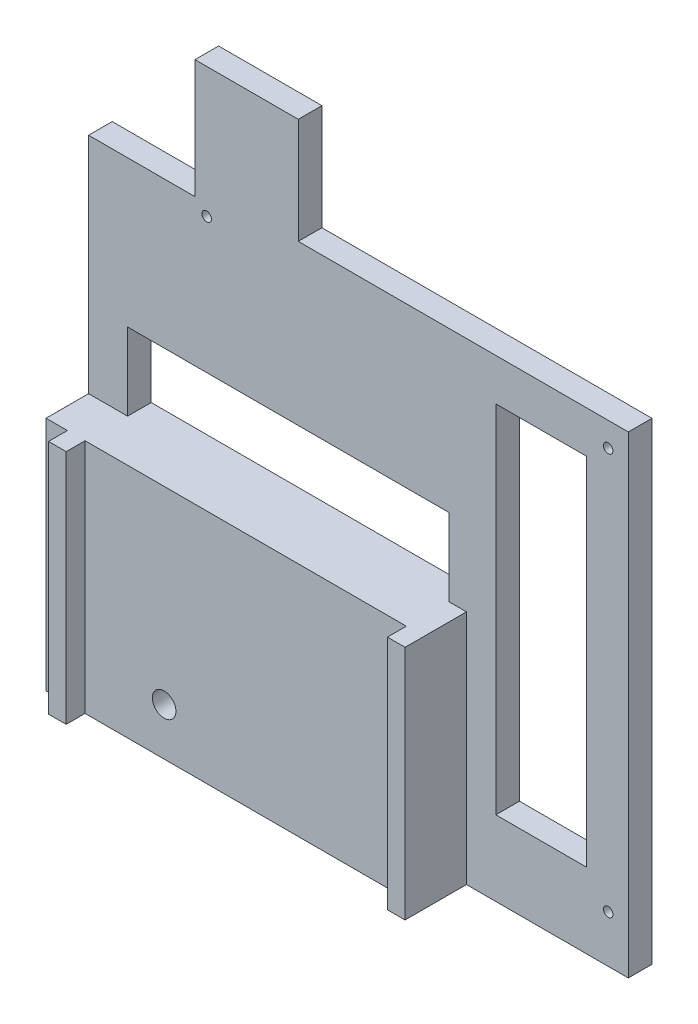
from build123d import *

# Parameters (mm, degrees)
SKETCH1_W           = 250
SKETCH1_H           = 245
BOSS_EXTRUDE1_DEPTH = 10
SKETCH6_W           = 160
SKETCH6_H           = 100
BOSS_EXTRUDE3_DEPTH = 18
SKETCH7_W           = 7.48
SKETCH7_H           = 100
BOSS_EXTRUDE4_DEPTH = 8
SKETCH8_W           = 152.52
SKETCH8_H           = 92.52
CUT_EXTRUDE2_DEPTH  = 20
SKETCH9_W           = 22
SKETCH9_H           = 22
BOSS_EXTRUDE5_DEPTH = 20
SKETCH11_W          = 18
SKETCH11_H          = 10
CUT_EXTRUDE4_DEPTH  = 22
SKETCH12_W          = 45.049420001
SKETCH12_H          = 50.23697577
SKETCH12_W_2        = 38.335801694
SKETCH12_H_2        = 150.676093074
SKETCH12_W_3        = 136
SKETCH12_H_3        = 32.712997572
CUT_EXTRUDE5_DEPTH  = 177.938548655
CUT_EXTRUDE6_REACH  = 180.682
SKETCH13_R          = 2
CUT_EXTRUDE7_REACH  = 179.243
SKETCH14_R          = 5


with BuildPart() as part:
    # Sketch1 → Boss-Extrude1 (new body)
    with BuildSketch(Plane.XY):
        Rectangle(SKETCH1_W, SKETCH1_H)
    extrude(amount=BOSS_EXTRUDE1_DEPTH)

    # Sketch6 → Boss-Extrude3 (add)
    with BuildSketch(Plane.XY.offset(10)):
        with Locations((-45, -72.5)):
            Rectangle(SKETCH6_W, SKETCH6_H)
    extrude(amount=BOSS_EXTRUDE3_DEPTH)

    # Sketch7 → Boss-Extrude4 (add)
    with BuildSketch(Plane.XY.offset(28)):
        with Locations((-112.22, -72.5)):
            Rectangle(SKETCH7_W, SKETCH7_H)
        with Locations((31.26, -72.5)):
            Rectangle(SKETCH7_W, SKETCH7_H)
    extrude(amount=BOSS_EXTRUDE4_DEPTH)

    # Sketch8 → Cut-Extrude2 (cut)
    with BuildSketch(Plane(origin=(0, 0, 0), x_dir=(-1, 0, 0), z_dir=(0, 0, -1))):
        with Locations((48.74, -76.24)):
            Rectangle(SKETCH8_W, SKETCH8_H)
    extrude(amount=-CUT_EXTRUDE2_DEPTH, mode=Mode.SUBTRACT)

    # Sketch9 → Boss-Extrude5 (add)
    with BuildSketch(Plane(origin=(0, 0, 20), x_dir=(-1, 0, 0), z_dir=(0, 0, -1))):
        with Locations((75, -102.5)):
            Rectangle(SKETCH9_W, SKETCH9_H)
    extrude(amount=BOSS_EXTRUDE5_DEPTH)

    # Sketch11 → Cut-Extrude4 (cut)
    with BuildSketch(Plane.XZ.offset(113.5)):
        with Locations((-75, 15)):
            Rectangle(SKETCH11_W, SKETCH11_H)
    extrude(amount=-CUT_EXTRUDE4_DEPTH, mode=Mode.SUBTRACT)

    # Sketch12 → Cut-Extrude5 (cut, through all)
    with BuildSketch(Plane.XY.offset(10)):
        with Locations((-102.47529, 97.381512115)):
            Rectangle(SKETCH12_W, SKETCH12_H)
        Polygon((125, 122.5), (-36.216929401, 122.5), (-36.216929401, 77.729730554), (103.525751024, 77.729730554), (103.525751024, -122.5), (125, -122.5), align=None)
        with Locations((66.600723088, -15.375111538)):
            Rectangle(SKETCH12_W_2, SKETCH12_H_2)
        with Locations((-40.48, -6.143501214)):
            Rectangle(SKETCH12_W_3, SKETCH12_H_3)
    extrude(amount=-CUT_EXTRUDE5_DEPTH, mode=Mode.SUBTRACT)

    # Sketch13 → Cut-Extrude6 (cut, up to next)
    with BuildSketch(Plane(origin=(0, 0, 0), x_dir=(-1, 0, 0), z_dir=(0, 0, -1)), mode=Mode.PRIVATE) as cut_extrude6_sk1:
        with Locations((75, -102.5)):
            Circle(SKETCH13_R)
    cut_extrude6_tool1 = extrude(cut_extrude6_sk1.sketch, amount=-CUT_EXTRUDE6_REACH, mode=Mode.PRIVATE) & part.part
    # Sketch13 → Cut-Extrude6 (cut, up to next)
    with BuildSketch(Plane(origin=(0, 0, 0), x_dir=(-1, 0, 0), z_dir=(0, 0, -1)), mode=Mode.PRIVATE) as cut_extrude6_sk2:
        with Locations((-95, -102.5)):
            Circle(SKETCH13_R)
    cut_extrude6_tool2 = extrude(cut_extrude6_sk2.sketch, amount=-CUT_EXTRUDE6_REACH, mode=Mode.PRIVATE) & part.part
    # Sketch13 → Cut-Extrude6 (cut, up to next)
    with BuildSketch(Plane(origin=(0, 0, 0), x_dir=(-1, 0, 0), z_dir=(0, 0, -1)), mode=Mode.PRIVATE) as cut_extrude6_sk3:
        with Locations((75, 67.5)):
            Circle(SKETCH13_R)
    cut_extrude6_tool3 = extrude(cut_extrude6_sk3.sketch, amount=-CUT_EXTRUDE6_REACH, mode=Mode.PRIVATE) & part.part
    # Sketch13 → Cut-Extrude6 (cut, up to next)
    with BuildSketch(Plane(origin=(0, 0, 0), x_dir=(-1, 0, 0), z_dir=(0, 0, -1)), mode=Mode.PRIVATE) as cut_extrude6_sk4:
        with Locations((-95, 67.5)):
            Circle(SKETCH13_R)
    cut_extrude6_tool4 = extrude(cut_extrude6_sk4.sketch, amount=-CUT_EXTRUDE6_REACH, mode=Mode.PRIVATE) & part.part
    add(cut_extrude6_tool1.solids().sort_by_distance((-75, -102.5, 0))[0], mode=Mode.SUBTRACT)
    add(cut_extrude6_tool2.solids().sort_by_distance((95, -102.5, 0))[0], mode=Mode.SUBTRACT)
    add(cut_extrude6_tool3.solids().sort_by_distance((-75, 67.5, 0))[0], mode=Mode.SUBTRACT)
    add(cut_extrude6_tool4.solids().sort_by_distance((95, 67.5, 0))[0], mode=Mode.SUBTRACT)

    # Sketch14 → Cut-Extrude7 (cut, up to next)
    with BuildSketch(Plane.XY.offset(28), mode=Mode.PRIVATE) as cut_extrude7_sk1:
        with Locations((-75, -102.5)):
            Circle(SKETCH14_R)
    cut_extrude7_tool1 = extrude(cut_extrude7_sk1.sketch, amount=-CUT_EXTRUDE7_REACH, mode=Mode.PRIVATE) & part.part
    add(cut_extrude7_tool1.solids().sort_by_distance((-75, -102.5, 28))[0], mode=Mode.SUBTRACT)


solid = part.part
